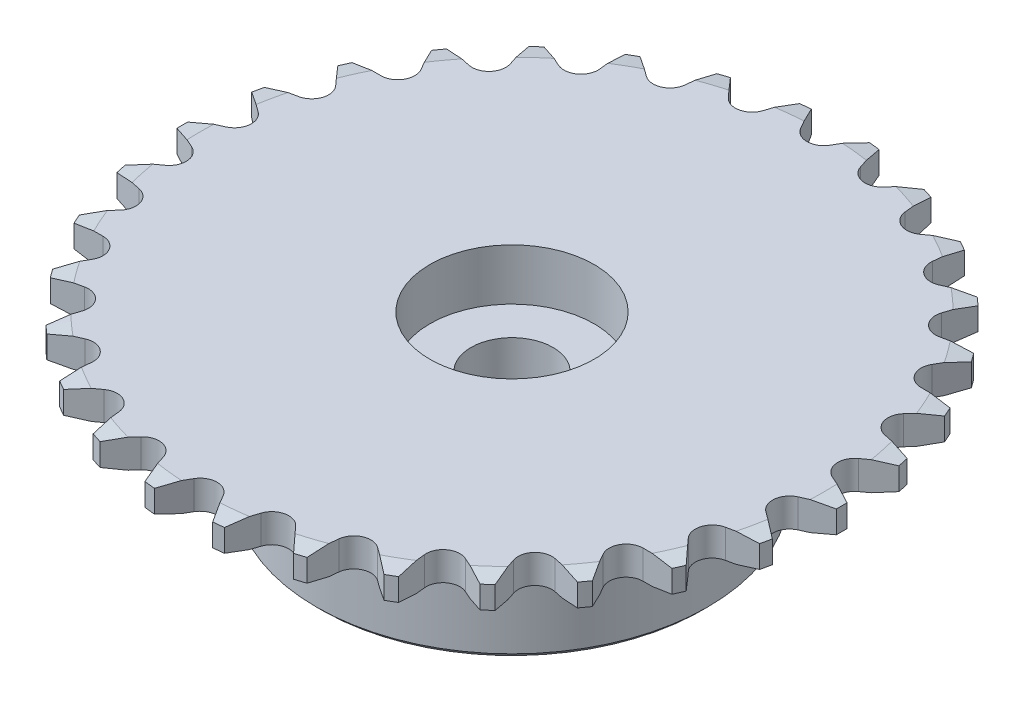
from build123d import *

# Parameters (mm, degrees)
CUT_EXTRUDE1_REACH = 50.109
CIRPATTERN1_START  = -2.794
CIRPATTERN1_DEPTH  = 2.794
SKETCH3_R          = 4
CUT_EXTRUDE2_DEPTH = 49.025751431
SKETCH5_R          = 2.25
CUT_EXTRUDE3_DEPTH = 20
SKETCH6_R          = 2.25
CUT_EXTRUDE4_DEPTH = 20
SKETCH7_R          = 7
CUT_EXTRUDE5_DEPTH = 7
SKETCH8_R          = 8
CUT_EXTRUDE6_DEPTH = 5


# Read off the part's stored shape, not the designer's step: CirPattern1
with BuildPart() as part:
    # Sketch1 → Revolve2 (revolve)
    with BuildSketch(Plane.XY, mode=Mode.PRIVATE) as revolve2_sk:
        Polygon((0, 0), (30.374501841, 0), (32.113107142, -0.306563023), (32.113107142, -2.487436977), (30.374501841, -2.794), (19.05, -2.794), (19.05, -15.375), (18.55, -15.875), (0, -15.875), align=None)
    revolve(revolve2_sk.sketch.rotate(Axis((0, 0, 0), (0, -1, 0)), 180), axis=Axis((0, 0, 0), (0, -1, 0)))

    # Cut-Extrude1: up to this face of the body (flat: up to its plane)
    cut_extrude1_end = Plane(part.part.faces().sort_by_distance((29.515381192, -2.794, 0))[0])
    # Sketch2 → Cut-Extrude1 (cut, up to the picked face)
    with BuildSketch(Plane(origin=(0, 0, 0), x_dir=(1, 0, 0), z_dir=(0, 1, 0)), mode=Mode.PRIVATE) as cut_extrude1_sk1:
        with BuildLine():
            Line((1.428941916, 29.549501841), (2.836569262, 31.987583922))
            ThreePointArc((2.836569262, 31.987583922), (0, 32.113107142), (-2.836569262, 31.987583922))
            Line((-2.836569262, 31.987583922), (-1.428941916, 29.549501841))
            ThreePointArc((-1.428941916, 29.549501841), (0, 28.724501841), (1.428941916, 29.549501841))
        make_face()
    cut_extrude1_tool1 = split(extrude(cut_extrude1_sk1.sketch, amount=-CUT_EXTRUDE1_REACH, mode=Mode.PRIVATE), bisect_by=cut_extrude1_end, keep=Keep.BOTH, mode=Mode.PRIVATE)
    add(cut_extrude1_tool1.solids().sort_by(Axis((0, 0, -30.720189), (0, -1, 0)))[0], mode=Mode.SUBTRACT)

    # CirPattern1 outline → CirPattern1 (cut)
    with BuildSketch(Plane(origin=(0, 0, 0), x_dir=(1, 0, 0), z_dir=(0, 1, 0)).offset(CIRPATTERN1_START)):
        with BuildLine():
            ThreePointArc((-29.120344913, -13.537250921), (-27.810766579, -16.056553571), (-26.283775651, -18.450333001))
            Line((-26.283775651, -18.450333001), (-24.876148306, -16.012250921))
            ThreePointArc((-24.876148306, -16.012250921), (-24.876148306, -14.362250921), (-26.305090222, -13.537250921))
            Line((-26.305090222, -13.537250921), (-29.120344913, -13.537250921))
        make_face()
        with BuildLine():
            ThreePointArc((-3.876009241, 31.878334378), (-6.676690404, 31.411358704), (-9.425176076, 30.698822555))
            Line((-9.425176076, 30.698822555), (-7.541402998, 28.606680599))
            ThreePointArc((-7.541402998, 28.606680599), (-5.972159746, 28.096802558), (-4.745970784, 29.200868059))
            Line((-4.745970784, 29.200868059), (-3.876009241, 31.878334378))
        make_face()
        with BuildLine():
            ThreePointArc((-10.41918754, 30.375848652), (-13.061577398, 29.336783161), (-15.601857469, 28.068375333))
            Line((-15.601857469, 28.068375333), (-13.32426858, 26.413610145))
            ThreePointArc((-13.32426858, 26.413610145), (-11.683307453, 26.24113818), (-10.713461787, 27.576016221))
            Line((-10.713461787, 27.576016221), (-10.41918754, 30.375848652))
        make_face()
        with BuildLine():
            ThreePointArc((-16.506997347, 27.545792581), (-18.875610783, 25.980049421), (-21.096662824, 24.211205423))
            Line((-21.096662824, 24.211205423), (-18.524799689, 23.06613818))
            ThreePointArc((-18.524799689, 23.06613818), (-16.883838562, 23.238610145), (-16.212723101, 24.74596015))
            Line((-16.212723101, 24.74596015), (-16.506997347, 27.545792581))
        make_face()
        with BuildLine():
            ThreePointArc((-21.873372161, 23.511853194), (-23.864689403, 21.487862854), (-25.669442781, 19.295889657))
            Line((-25.669442781, 19.295889657), (-22.91570816, 18.710565294))
            ThreePointArc((-22.91570816, 18.710565294), (-21.346464908, 19.220443334), (-21.003410618, 20.834386876))
            Line((-21.003410618, 20.834386876), (-21.873372161, 23.511853194))
        make_face()
        with BuildLine():
            ThreePointArc((-26.283775651, 18.450333001), (-27.81076658, 16.056553571), (-29.120344913, 13.537250921))
            Line((-29.120344913, 13.537250921), (-26.305090222, 13.537250921))
            ThreePointArc((-26.305090222, 13.537250921), (-24.876148306, 14.362250921), (-24.876148306, 16.012250921))
            Line((-24.876148306, 16.012250921), (-26.283775651, 18.450333001))
        make_face()
        with BuildLine():
            ThreePointArc((-29.545452022, 12.582444721), (-30.541379806, 9.923495849), (-31.298548237, 7.186969361))
            Line((-31.298548237, 7.186969361), (-28.544813616, 7.772293723))
            ThreePointArc((-28.544813616, 7.772293723), (-27.318624654, 8.876359224), (-27.661678943, 10.490302765))
            Line((-27.661678943, 10.490302765), (-29.545452022, 12.582444721))
        make_face()
        with BuildLine():
            ThreePointArc((-31.515850364, 6.164643229), (-31.937188181, 3.35673374), (-32.108854816, 0.522582753))
            Line((-32.108854816, 0.522582753), (-29.536991681, 1.667649995))
            ThreePointArc((-29.536991681, 1.667649995), (-28.567146015, 3.002528036), (-29.238261476, 4.509878041))
            Line((-29.238261476, 4.509878041), (-31.515850364, 6.164643229))
        make_face()
        with BuildLine():
            ThreePointArc((-32.108854816, -0.522582753), (-31.937188181, -3.35673374), (-31.515850364, -6.164643229))
            Line((-31.515850364, -6.164643229), (-29.238261476, -4.509878041))
            ThreePointArc((-29.238261476, -4.509878041), (-28.567146015, -3.002528036), (-29.536991681, -1.667649995))
            Line((-29.536991681, -1.667649995), (-32.108854816, -0.522582753))
        make_face()
        with BuildLine():
            ThreePointArc((-31.298548237, -7.186969361), (-30.541379806, -9.923495849), (-29.545452022, -12.582444721))
            Line((-29.545452022, -12.582444721), (-27.661678943, -10.490302765))
            ThreePointArc((-27.661678943, -10.490302765), (-27.318624654, -8.876359224), (-28.544813616, -7.772293723))
            Line((-28.544813616, -7.772293723), (-31.298548237, -7.186969361))
        make_face()
        with BuildLine():
            Line((7.541402998, 28.606680599), (9.425176076, 30.698822555))
            ThreePointArc((9.425176076, 30.698822555), (6.676690404, 31.411358704), (3.876009241, 31.878334378))
            Line((3.876009241, 31.878334378), (4.745970784, 29.200868059))
            ThreePointArc((4.745970784, 29.200868059), (5.972159746, 28.096802558), (7.541402998, 28.606680599))
        make_face()
        with BuildLine():
            Line((13.32426858, 26.413610145), (15.601857469, 28.068375333))
            ThreePointArc((15.601857469, 28.068375333), (13.061577398, 29.336783161), (10.41918754, 30.375848652))
            Line((10.41918754, 30.375848652), (10.713461787, 27.576016221))
            ThreePointArc((10.713461787, 27.576016221), (11.683307453, 26.24113818), (13.32426858, 26.413610145))
        make_face()
        with BuildLine():
            Line((18.524799689, 23.06613818), (21.096662824, 24.211205423))
            ThreePointArc((21.096662824, 24.211205423), (18.875610783, 25.980049421), (16.506997347, 27.545792581))
            Line((16.506997347, 27.545792581), (16.212723101, 24.74596015))
            ThreePointArc((16.212723101, 24.74596015), (16.883838562, 23.238610145), (18.524799689, 23.06613818))
        make_face()
        with BuildLine():
            Line((22.91570816, 18.710565294), (25.669442781, 19.295889657))
            ThreePointArc((25.669442781, 19.295889657), (23.864689403, 21.487862854), (21.873372161, 23.511853194))
            Line((21.873372161, 23.511853194), (21.003410618, 20.834386876))
            ThreePointArc((21.003410618, 20.834386876), (21.346464908, 19.220443334), (22.91570816, 18.710565294))
        make_face()
        with BuildLine():
            Line((26.305090222, 13.537250921), (29.120344913, 13.537250921))
            ThreePointArc((29.120344913, 13.537250921), (27.81076658, 16.056553571), (26.283775651, 18.450333001))
            Line((26.283775651, 18.450333001), (24.876148306, 16.012250921))
            ThreePointArc((24.876148306, 16.012250921), (24.876148306, 14.362250921), (26.305090222, 13.537250921))
        make_face()
        with BuildLine():
            Line((28.544813616, 7.772293723), (31.298548237, 7.186969361))
            ThreePointArc((31.298548237, 7.186969361), (30.541379806, 9.923495849), (29.545452022, 12.582444721))
            Line((29.545452022, 12.582444721), (27.661678943, 10.490302765))
            ThreePointArc((27.661678943, 10.490302765), (27.318624654, 8.876359224), (28.544813616, 7.772293723))
        make_face()
        with BuildLine():
            Line((29.536991681, 1.667649995), (32.108854816, 0.522582753))
            ThreePointArc((32.108854816, 0.522582753), (31.937188181, 3.35673374), (31.515850364, 6.164643229))
            Line((31.515850364, 6.164643229), (29.238261476, 4.509878041))
            ThreePointArc((29.238261476, 4.509878041), (28.567146015, 3.002528036), (29.536991681, 1.667649995))
        make_face()
        with BuildLine():
            Line((29.238261476, -4.509878041), (31.515850364, -6.164643229))
            ThreePointArc((31.515850364, -6.164643229), (31.937188181, -3.35673374), (32.108854816, -0.522582753))
            Line((32.108854816, -0.522582753), (29.536991681, -1.667649995))
            ThreePointArc((29.536991681, -1.667649995), (28.567146015, -3.002528036), (29.238261476, -4.509878041))
        make_face()
        with BuildLine():
            Line((27.661678943, -10.490302765), (29.545452022, -12.582444721))
            ThreePointArc((29.545452022, -12.582444721), (30.541379806, -9.923495849), (31.298548237, -7.186969361))
            Line((31.298548237, -7.186969361), (28.544813616, -7.772293723))
            ThreePointArc((28.544813616, -7.772293723), (27.318624654, -8.876359224), (27.661678943, -10.490302765))
        make_face()
        with BuildLine():
            Line((24.876148306, -16.012250921), (26.283775651, -18.450333001))
            ThreePointArc((26.283775651, -18.450333001), (27.810766579, -16.056553571), (29.120344913, -13.537250921))
            Line((29.120344913, -13.537250921), (26.305090222, -13.537250921))
            ThreePointArc((26.305090222, -13.537250921), (24.876148306, -14.362250921), (24.876148306, -16.012250921))
        make_face()
        with BuildLine():
            Line((21.003410618, -20.834386876), (21.873372161, -23.511853194))
            ThreePointArc((21.873372161, -23.511853194), (23.864689403, -21.487862854), (25.669442781, -19.295889657))
            Line((25.669442781, -19.295889657), (22.91570816, -18.710565294))
            ThreePointArc((22.91570816, -18.710565294), (21.346464908, -19.220443334), (21.003410618, -20.834386876))
        make_face()
        with BuildLine():
            Line((16.212723101, -24.74596015), (16.506997347, -27.545792581))
            ThreePointArc((16.506997347, -27.545792581), (18.875610783, -25.98004942), (21.096662824, -24.211205423))
            Line((21.096662824, -24.211205423), (18.524799689, -23.06613818))
            ThreePointArc((18.524799689, -23.06613818), (16.883838562, -23.238610145), (16.212723101, -24.74596015))
        make_face()
        with BuildLine():
            Line((10.713461787, -27.576016221), (10.41918754, -30.375848652))
            ThreePointArc((10.41918754, -30.375848652), (13.061577398, -29.33678316), (15.601857469, -28.068375333))
            Line((15.601857469, -28.068375333), (13.32426858, -26.413610145))
            ThreePointArc((13.32426858, -26.413610145), (11.683307453, -26.24113818), (10.713461787, -27.576016221))
        make_face()
        with BuildLine():
            Line((4.745970784, -29.200868059), (3.876009241, -31.878334377))
            ThreePointArc((3.876009241, -31.878334377), (6.676690403, -31.411358703), (9.425176076, -30.698822555))
            Line((9.425176076, -30.698822555), (7.541402998, -28.606680599))
            ThreePointArc((7.541402998, -28.606680599), (5.972159746, -28.096802558), (4.745970784, -29.200868059))
        make_face()
        with BuildLine():
            Line((-1.428941916, -29.549501841), (-2.836569262, -31.987583922))
            ThreePointArc((-2.836569262, -31.987583922), (0, -32.113107142), (2.836569262, -31.987583922))
            Line((2.836569262, -31.987583922), (1.428941916, -29.549501841))
            ThreePointArc((1.428941916, -29.549501841), (0, -28.724501841), (-1.428941916, -29.549501841))
        make_face()
        with BuildLine():
            Line((-7.541402998, -28.606680599), (-9.425176076, -30.698822555))
            ThreePointArc((-9.425176076, -30.698822555), (-6.676690403, -31.411358703), (-3.876009241, -31.878334377))
            Line((-3.876009241, -31.878334377), (-4.745970784, -29.200868059))
            ThreePointArc((-4.745970784, -29.200868059), (-5.972159746, -28.096802558), (-7.541402998, -28.606680599))
        make_face()
        with BuildLine():
            Line((-13.32426858, -26.413610145), (-15.601857469, -28.068375333))
            ThreePointArc((-15.601857469, -28.068375333), (-13.061577398, -29.33678316), (-10.41918754, -30.375848652))
            Line((-10.41918754, -30.375848652), (-10.713461787, -27.576016221))
            ThreePointArc((-10.713461787, -27.576016221), (-11.683307453, -26.24113818), (-13.32426858, -26.413610145))
        make_face()
        with BuildLine():
            Line((-18.524799689, -23.06613818), (-21.096662824, -24.211205423))
            ThreePointArc((-21.096662824, -24.211205423), (-18.875610783, -25.98004942), (-16.506997347, -27.545792581))
            Line((-16.506997347, -27.545792581), (-16.212723101, -24.74596015))
            ThreePointArc((-16.212723101, -24.74596015), (-16.883838562, -23.238610145), (-18.524799689, -23.06613818))
        make_face()
        with BuildLine():
            Line((-22.91570816, -18.710565294), (-25.669442781, -19.295889657))
            ThreePointArc((-25.669442781, -19.295889657), (-23.864689403, -21.487862854), (-21.873372161, -23.511853194))
            Line((-21.873372161, -23.511853194), (-21.003410618, -20.834386876))
            ThreePointArc((-21.003410618, -20.834386876), (-21.346464908, -19.220443334), (-22.91570816, -18.710565294))
        make_face()
    extrude(amount=CIRPATTERN1_DEPTH, mode=Mode.SUBTRACT)

    # Sketch3 → Cut-Extrude2 (cut, through all)
    with BuildSketch(Plane.XZ.offset(15.875)):
        Circle(SKETCH3_R)
    extrude(amount=-CUT_EXTRUDE2_DEPTH, mode=Mode.SUBTRACT)

    # Sketch5 → Cut-Extrude3 (cut)
    with BuildSketch(Plane(origin=(0, 0, 0), x_dir=(0, 0, -1), z_dir=(1, 0, 0))):
        with Locations((0, -11.375)):
            Circle(SKETCH5_R)
    extrude(amount=-CUT_EXTRUDE3_DEPTH, mode=Mode.SUBTRACT)

    # Sketch6 → Cut-Extrude4 (cut)
    with BuildSketch(Plane.XY):
        with Locations((0, -11.375)):
            Circle(SKETCH6_R)
    extrude(amount=-CUT_EXTRUDE4_DEPTH, mode=Mode.SUBTRACT)

    # Sketch7 → Cut-Extrude5 (cut)
    with BuildSketch(Plane.XZ.offset(15.875)):
        Circle(SKETCH7_R)
    extrude(amount=-CUT_EXTRUDE5_DEPTH, mode=Mode.SUBTRACT)

    # Sketch8 → Cut-Extrude6 (cut)
    with BuildSketch(Plane(origin=(0, 0, 0), x_dir=(1, 0, 0), z_dir=(0, 1, 0))):
        with Locations(Location((0, 0, 0), (0, 0, 180))):
            Circle(SKETCH8_R)
    extrude(amount=-CUT_EXTRUDE6_DEPTH, mode=Mode.SUBTRACT)


solid = part.part
